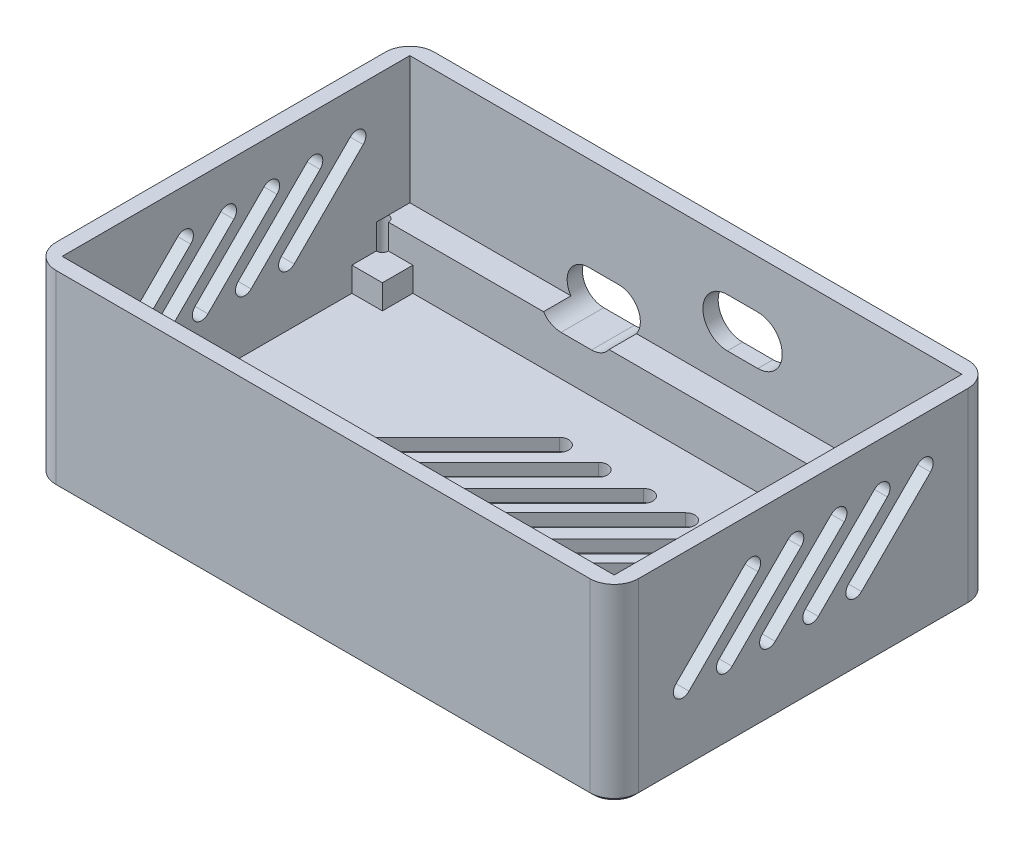
from build123d import *

# Parameters (mm, degrees)
CUERPO_DEPTH                  = 31
CROQUIS_HUECO_ESP32_W         = 90.5
CROQUIS_HUECO_ESP32_H         = 57
HUECO_ESP32_DEPTH             = 20.9
CROQUIS_HUECO_PCB_W           = 90.5
CROQUIS_HUECO_PCB_H           = 52.5
HUECO_PCB_DEPTH               = 8.1
CROQUIS_APOYOS_W              = 5
CROQUIS_APOYOS_H              = 5
APOYOS_PCB_DEPTH              = 4
CROQUIS_ALIVIOS_R             = 1
ALIVIOS_ESQUINAS_DEPTH        = 8.1
SALIDAS_USB_Y_PANEL_DEPTH     = 66.928939018
VENTILAS_LATERALES_DEPTH      = 66.928939018
VENTILAS_LATERALES_DEPTH_BACK = 66.928939018
REJILLA_PISO_DEPTH            = 2
CHAFLAN_BASE_SIZE             = 0.6


with BuildPart() as part:
    # Croquis_contorno → Cuerpo (new body)
    with BuildSketch(Plane(origin=(0, 0, 0), x_dir=(1, 0, 0), z_dir=(0, 1, 0))):
        with BuildLine():
            Line((-43.75, -28.75), (43.75, -28.75))
            ThreePointArc((43.75, -28.75), (46.578427125, -27.578427125), (47.75, -24.75))
            Line((47.75, -24.75), (47.75, 29.25))
            ThreePointArc((47.75, 29.25), (46.578427125, 32.078427125), (43.75, 33.25))
            Line((43.75, 33.25), (-43.75, 33.25))
            ThreePointArc((-43.75, 33.25), (-46.578427125, 32.078427125), (-47.75, 29.25))
            Line((-47.75, 29.25), (-47.75, -24.75))
            ThreePointArc((-47.75, -24.75), (-46.578427125, -27.578427125), (-43.75, -28.75))
        make_face()
    extrude(amount=CUERPO_DEPTH)

    # Croquis_hueco_ESP32 → Hueco_ESP32 (cut)
    with BuildSketch(Plane(origin=(0, 31, 0), x_dir=(1, 0, 0), z_dir=(0, 1, 0))):
        with Locations((0, 2.25)):
            Rectangle(CROQUIS_HUECO_ESP32_W, CROQUIS_HUECO_ESP32_H)
    extrude(amount=-HUECO_ESP32_DEPTH, mode=Mode.SUBTRACT)

    # Croquis_hueco_PCB → Hueco_PCB (cut)
    with BuildSketch(Plane(origin=(0, 10.1, 0), x_dir=(1, 0, 0), z_dir=(0, 1, 0))):
        Rectangle(CROQUIS_HUECO_PCB_W, CROQUIS_HUECO_PCB_H)
    extrude(amount=-HUECO_PCB_DEPTH, mode=Mode.SUBTRACT)

    # Croquis_apoyos → Apoyos_PCB (add)
    with BuildSketch(Plane(origin=(0, 2, 0), x_dir=(1, 0, 0), z_dir=(0, 1, 0))):
        with Locations((-42.75, -23.75)):
            Rectangle(CROQUIS_APOYOS_W, CROQUIS_APOYOS_H)
        with Locations((-42.75, 23.75)):
            Rectangle(CROQUIS_APOYOS_W, CROQUIS_APOYOS_H)
        with Locations((42.75, -23.75)):
            Rectangle(CROQUIS_APOYOS_W, CROQUIS_APOYOS_H)
        with Locations((42.75, 23.75)):
            Rectangle(CROQUIS_APOYOS_W, CROQUIS_APOYOS_H)
    extrude(amount=APOYOS_PCB_DEPTH)

    # Croquis_alivios → Alivios_esquinas (cut)
    with BuildSketch(Plane(origin=(0, 2, 0), x_dir=(1, 0, 0), z_dir=(0, 1, 0))):
        with Locations((-45.25, -26.25)):
            Circle(CROQUIS_ALIVIOS_R)
        with Locations((-45.25, 26.25)):
            Circle(CROQUIS_ALIVIOS_R)
        with Locations((45.25, -26.25)):
            Circle(CROQUIS_ALIVIOS_R)
        with Locations((45.25, 26.25)):
            Circle(CROQUIS_ALIVIOS_R)
    extrude(amount=ALIVIOS_ESQUINAS_DEPTH, mode=Mode.SUBTRACT)

    # Croquis_salidas → Salidas_USB_y_panel (cut, through all)
    with BuildSketch(Plane.XY):
        with BuildLine():
            Line((6.8, 23.1), (11.8, 23.1))
            ThreePointArc((11.8, 23.1), (15.8, 19.1), (11.8, 15.1))
            Line((11.8, 15.1), (6.8, 15.1))
            ThreePointArc((6.8, 15.1), (2.8, 19.1), (6.8, 23.1))
        make_face()
        with BuildLine():
            Line((-15.96, 15.6), (-10.96, 15.6))
            ThreePointArc((-10.96, 15.6), (-7.46, 12.1), (-10.96, 8.6))
            Line((-10.96, 8.6), (-15.96, 8.6))
            ThreePointArc((-15.96, 8.6), (-19.46, 12.1), (-15.96, 15.6))
        make_face()
    extrude(amount=-SALIDAS_USB_Y_PANEL_DEPTH, mode=Mode.SUBTRACT)

    # Croquis_ventilas → Ventilas_laterales (cut, two sides: drawn at the far end of the back side and taken through both)
    with BuildSketch(Plane(origin=(0, 0, 0), x_dir=(0, 0, -1), z_dir=(1, 0, 0)).offset(-VENTILAS_LATERALES_DEPTH_BACK)):
        with BuildLine():
            Line((-18.609650045, 13.003805922), (-7.295941546, 24.317514421))
            ThreePointArc((-7.295941546, 24.317514421), (-5.174621202, 24.317514421), (-5.174621202, 22.196194078))
            Line((-5.174621202, 22.196194078), (-16.488329701, 10.882485579))
            ThreePointArc((-16.488329701, 10.882485579), (-18.609650045, 10.882485579), (-18.609650045, 13.003805922))
        make_face()
        with BuildLine():
            Line((-11.538582233, 13.003805922), (-0.224873734, 24.317514421))
            ThreePointArc((-0.224873734, 24.317514421), (1.896446609, 24.317514421), (1.896446609, 22.196194078))
            Line((1.896446609, 22.196194078), (-9.41726189, 10.882485579))
            ThreePointArc((-9.41726189, 10.882485579), (-11.538582233, 10.882485579), (-11.538582233, 13.003805922))
        make_face()
        with BuildLine():
            Line((-4.467514421, 13.003805922), (6.846194078, 24.317514421))
            ThreePointArc((6.846194078, 24.317514421), (8.967514421, 24.317514421), (8.967514421, 22.196194078))
            Line((8.967514421, 22.196194078), (-2.346194078, 10.882485579))
            ThreePointArc((-2.346194078, 10.882485579), (-4.467514421, 10.882485579), (-4.467514421, 13.003805922))
        make_face()
        with BuildLine():
            Line((2.603553391, 13.003805922), (13.91726189, 24.317514421))
            ThreePointArc((13.91726189, 24.317514421), (16.038582233, 24.317514421), (16.038582233, 22.196194078))
            Line((16.038582233, 22.196194078), (4.724873734, 10.882485579))
            ThreePointArc((4.724873734, 10.882485579), (2.603553391, 10.882485579), (2.603553391, 13.003805922))
        make_face()
        with BuildLine():
            Line((9.674621202, 13.003805922), (20.988329701, 24.317514421))
            ThreePointArc((20.988329701, 24.317514421), (23.109650045, 24.317514421), (23.109650045, 22.196194078))
            Line((23.109650045, 22.196194078), (11.795941546, 10.882485579))
            ThreePointArc((11.795941546, 10.882485579), (9.674621202, 10.882485579), (9.674621202, 13.003805922))
        make_face()
    extrude(amount=VENTILAS_LATERALES_DEPTH + VENTILAS_LATERALES_DEPTH_BACK, mode=Mode.SUBTRACT)

    # Croquis_rejilla_piso → Rejilla_piso (cut)
    with BuildSketch(Plane(origin=(0, 0, 0), x_dir=(1, 0, 0), z_dir=(0, 1, 0))):
        with BuildLine():
            Line((-36.769552622, -11.185028843), (-7.778174593, 17.806349186))
            ThreePointArc((-7.778174593, 17.806349186), (-5.656854249, 17.806349186), (-5.656854249, 15.685028843))
            Line((-5.656854249, 15.685028843), (-34.648232278, -13.306349186))
            ThreePointArc((-34.648232278, -13.306349186), (-36.769552622, -13.306349186), (-36.769552622, -11.185028843))
        make_face()
        with BuildLine():
            Line((-29.69848481, -11.185028843), (-1.060660172, 17.452795796))
            ThreePointArc((-1.060660172, 17.452795796), (1.060660172, 17.452795796), (1.060660172, 15.331475452))
            Line((1.060660172, 15.331475452), (-27.577164466, -13.306349186))
            ThreePointArc((-27.577164466, -13.306349186), (-29.69848481, -13.306349186), (-29.69848481, -11.185028843))
        make_face()
        with BuildLine():
            Line((-22.273863607, -11.185028843), (6.363961031, 17.452795796))
            ThreePointArc((6.363961031, 17.452795796), (8.485281374, 17.452795796), (8.485281374, 15.331475452))
            Line((8.485281374, 15.331475452), (-20.152543264, -13.306349186))
            ThreePointArc((-20.152543264, -13.306349186), (-22.273863607, -13.306349186), (-22.273863607, -11.185028843))
        make_face()
        with BuildLine():
            Line((-15.379572491, -11.185028843), (13.258252147, 17.452795796))
            ThreePointArc((13.258252147, 17.452795796), (15.379572491, 17.452795796), (15.379572491, 15.331475452))
            Line((15.379572491, 15.331475452), (-13.258252147, -13.306349186))
            ThreePointArc((-13.258252147, -13.306349186), (-15.379572491, -13.306349186), (-15.379572491, -11.185028843))
        make_face()
        with BuildLine():
            Line((-7.954951288, -11.185028843), (20.68287335, 17.452795796))
            ThreePointArc((20.68287335, 17.452795796), (22.804193693, 17.452795796), (22.804193693, 15.331475452))
            Line((22.804193693, 15.331475452), (-5.833630945, -13.306349186))
            ThreePointArc((-5.833630945, -13.306349186), (-7.954951288, -13.306349186), (-7.954951288, -11.185028843))
        make_face()
        with BuildLine():
            Line((-1.060660172, -11.185028843), (27.577164466, 17.452795796))
            ThreePointArc((27.577164466, 17.452795796), (29.69848481, 17.452795796), (29.69848481, 15.331475452))
            Line((29.69848481, 15.331475452), (1.060660172, -13.306349186))
            ThreePointArc((1.060660172, -13.306349186), (-1.060660172, -13.306349186), (-1.060660172, -11.185028843))
        make_face()
        with BuildLine():
            Line((5.303300859, -11.185028843), (34.471455583, 17.983125881))
            ThreePointArc((34.471455583, 17.983125881), (36.592775926, 17.983125881), (36.592775926, 15.861805538))
            Line((36.592775926, 15.861805538), (7.424621202, -13.306349186))
            ThreePointArc((7.424621202, -13.306349186), (5.303300859, -13.306349186), (5.303300859, -11.185028843))
        make_face()
    extrude(amount=REJILLA_PISO_DEPTH, mode=Mode.SUBTRACT)

    # Chaflan_base
    chaflan_base_edges = [part.edges().sort_by_distance(p)[0] for p in [
        (0, 0, 28.75),
        (46.578427125, 0, 27.578427125),
        (47.75, 0, -2.25),
        (46.578427125, 0, -32.078427125),
        (0, 0, -33.25),
        (-46.578427125, 0, -32.078427125),
        (-47.75, 0, -2.25),
        (-46.578427125, 0, 27.578427125),
    ]]
    chamfer(chaflan_base_edges, length=CHAFLAN_BASE_SIZE)


solid = part.part
